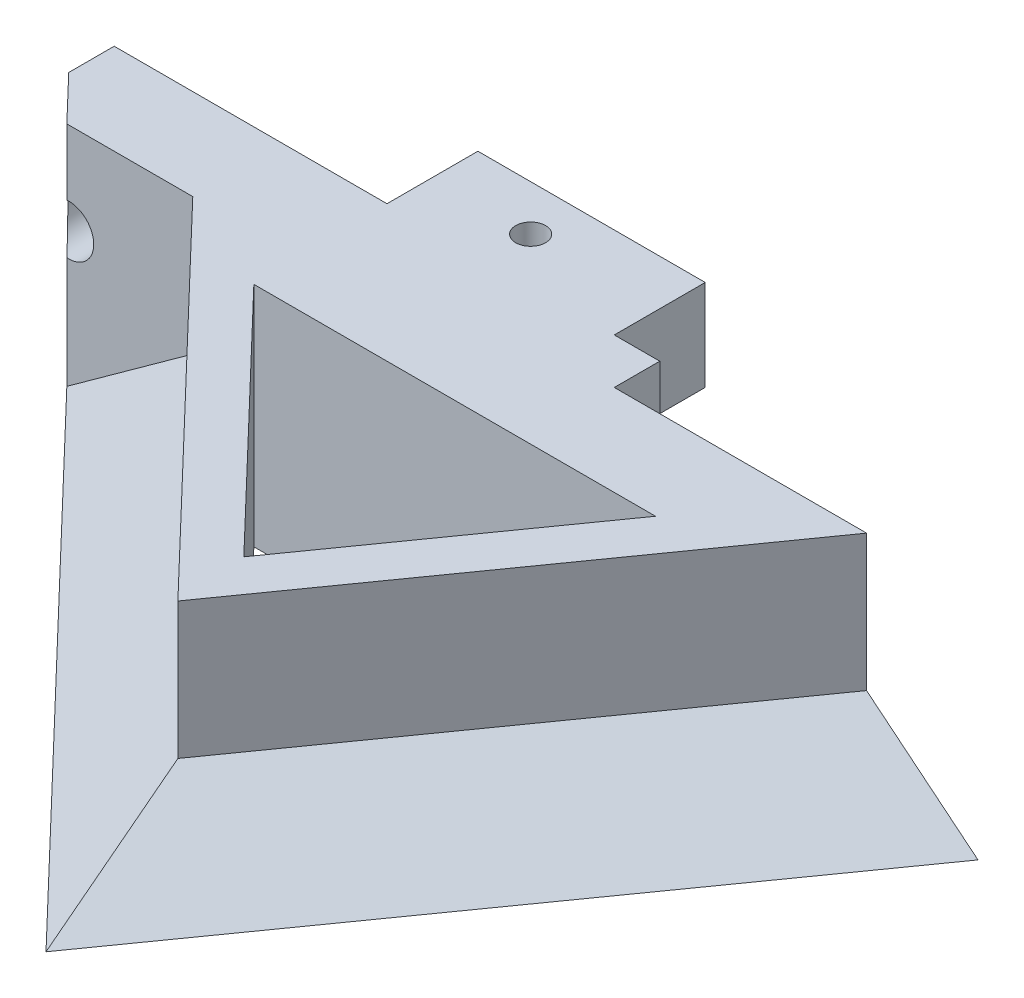
from build123d import *

# Parameters (mm, degrees)
SKETCH2_R           = 2.0828
BOSS_EXTRUDE1_DEPTH = 31.75
SKETCH4_W           = 31.75
SKETCH4_H           = 12.7
CUT_EXTRUDE1_DEPTH  = 19.05
SKETCH5_R           = 3.4925
CUT_EXTRUDE2_DEPTH  = 6.35
CUT_EXTRUDE6_DEPTH  = 19.05
CHAMFER5_SIZE       = 12.7
CHAMFER7_SIZE       = 12.7
SKETCH6_R           = 3.4925
CUT_EXTRUDE8_DEPTH  = 25.4
SKETCH15_R          = 3.4925
SKETCH15_R_2        = 2.0828
BOSS_EXTRUDE2_DEPTH = 6.35
SKETCH14_W          = 11.43
SKETCH14_H          = 13.97
CUT_EXTRUDE10_DEPTH = 6.35


with BuildPart() as part:
    # Sketch2 → Boss-Extrude1 (new body)
    with BuildSketch(Plane(origin=(0, 0, 0), x_dir=(1, 0, 0), z_dir=(0, 1, 0))):
        Polygon((-69.85, 6.35), (-76.2, 6.35), (-76.2, 0), (-127, 0), (-73.025, -76.2), (0, 0), (0, 6.35), (-38.1, 6.35), (-38.1, 19.05), (-69.85, 19.05), align=None)
        with Locations(Location((-51.816, 12.7, 0), (0, 0, 270))):
            Circle(SKETCH2_R, mode=Mode.SUBTRACT)
        Polygon((-38.556305928, -12.7), (-69.85, -12.7), (-76.2, -12.7), (-94.65927881, -12.7), (-70.815515335, -46.361783729), align=None, mode=Mode.SUBTRACT)
    extrude(amount=BOSS_EXTRUDE1_DEPTH)

    # Sketch4 → Cut-Extrude1 (cut)
    with BuildSketch(Plane.XZ):
        with Locations((-53.975, -12.7)):
            Rectangle(SKETCH4_W, SKETCH4_H)
    extrude(amount=-CUT_EXTRUDE1_DEPTH, mode=Mode.SUBTRACT)

    # Sketch5 → Cut-Extrude2 (cut)
    with BuildSketch(Plane(origin=(0, 19.05, 0), x_dir=(-1, 0, 0), z_dir=(0, -1, 0))):
        with Locations(Location((51.816, 12.7, 0), (0, 0, 90))):
            Circle(SKETCH5_R)
    extrude(amount=-CUT_EXTRUDE2_DEPTH, mode=Mode.SUBTRACT)

    # Sketch3 → Cut-Extrude6 (cut)
    with BuildSketch(Plane(origin=(0, 31.75, 0), x_dir=(1, 0, 0), z_dir=(0, 1, 0))):
        Polygon((-127, 0), (-73.025, -76.2), (-6.085416667, -6.35), (-23.67573173, -6.35), (-71.552010223, -56.307855819), (-111.436741429, 0), align=None)
    extrude(amount=-CUT_EXTRUDE6_DEPTH, mode=Mode.SUBTRACT)

    # Chamfer5
    chamfer5_edges = [part.edges().sort_by_distance(p)[0] for p in [
        (-39.555208333, 12.7, 41.275),
    ]]
    chamfer(chamfer5_edges, length=CHAMFER5_SIZE - 0.0001)  # a hair under: the kernel refuses the full size

    # Chamfer7
    chamfer7_edges = [part.edges().sort_by_distance(p)[0] for p in [
        (-103.750412518, 12.7, 32.822947033),
    ]]
    chamfer(chamfer7_edges, length=CHAMFER7_SIZE - 0.0001)  # a hair under: the kernel refuses the full size

    # Sketch6 → Cut-Extrude8 (cut)
    with BuildSketch(Plane(origin=(0, 0, -6.35), x_dir=(-1, 0, 0), z_dir=(0, 0, -1))):
        with Locations((6.35, 19.05)):
            Circle(SKETCH6_R)
    extrude(amount=-CUT_EXTRUDE8_DEPTH, mode=Mode.SUBTRACT)

    # Sketch15 → Boss-Extrude2 (add)
    with BuildSketch(Plane(origin=(0, 0, -6.35), x_dir=(-1, 0, 0), z_dir=(0, 0, -1))):
        with Locations((6.35, 19.05)):
            Circle(SKETCH15_R)
        with Locations((6.35, 19.05)):
            Circle(SKETCH15_R_2, mode=Mode.SUBTRACT)
    extrude(amount=-BOSS_EXTRUDE2_DEPTH)

    # Sketch14 → Cut-Extrude10 (cut)
    with BuildSketch(Plane(origin=(0, 0, -6.35), x_dir=(-1, 0, 0), z_dir=(0, 0, -1))):
        with Locations((5.715, 6.985)):
            Rectangle(SKETCH14_W, SKETCH14_H)
    extrude(amount=-CUT_EXTRUDE10_DEPTH, mode=Mode.SUBTRACT)


with BuildPart() as body_2:
    # Mirror1: mirrored copy
    add(part.part.mirror(Plane(origin=(0, 31.75, 0), x_dir=(0, 0, 1), z_dir=(-1, 0, 0))))


solid = body_2.part
